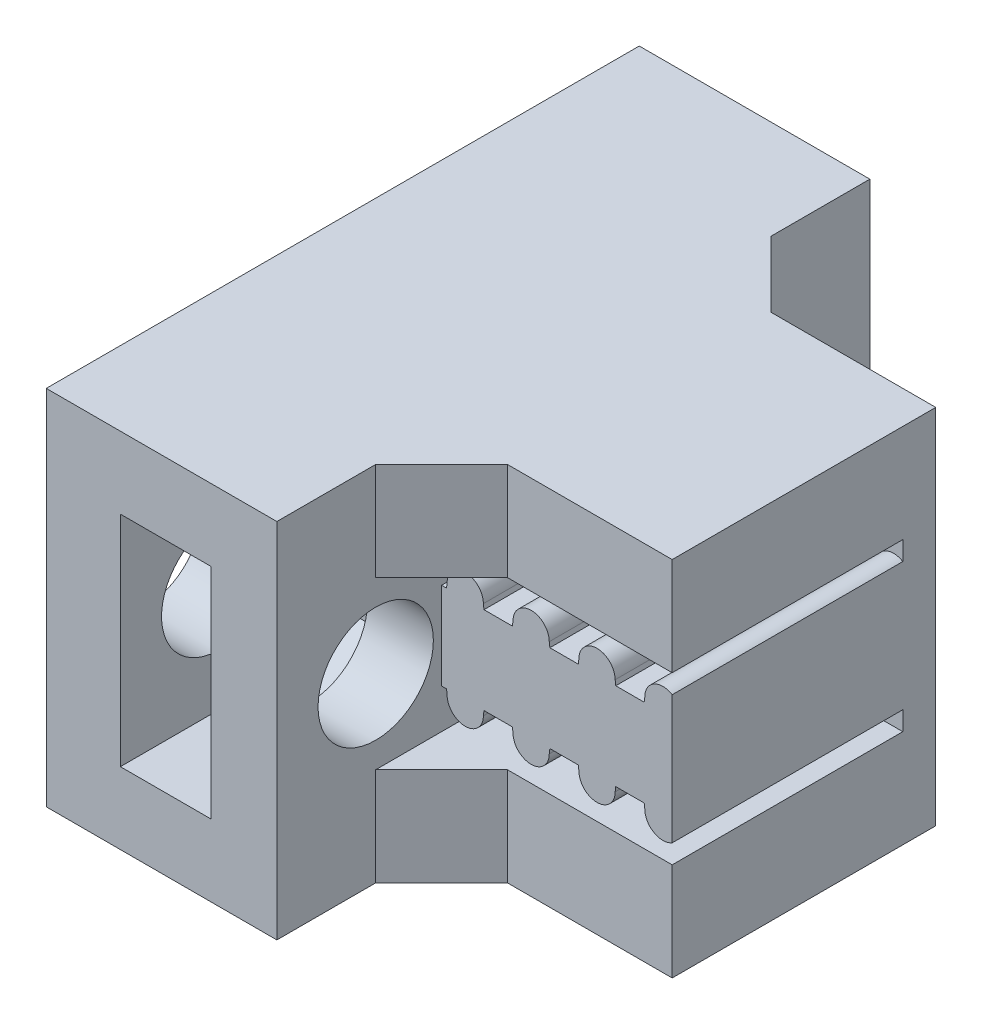
from build123d import *

# Parameters (mm, degrees)
SKETCH_1_W          = 7
SKETCH_1_H          = 11
EXTRUDE_1_DEPTH     = 8
CUT_EXTRUDE_1_DEPTH = 7
SKETCH_3_W          = 18
SKETCH_3_H          = 11
SKETCH_3_R          = 1.75
EXTRUDE_2_DEPTH     = 7
CUT_EXTRUDE_START   = -2
SKETCH_5_W          = 0.875
SKETCH_5_H          = 2.65
SKETCH_5_R          = 1.75
CUT_EXTRUDE_3_DEPTH = 2.75
CHAMFER_1_SIZE      = 2


with BuildPart() as part:
    # Эскиз1 → Бобышка-Вытянуть1 (new body)
    with BuildSketch(Plane.XY):
        Rectangle(SKETCH_1_W, SKETCH_1_H)
    extrude(amount=EXTRUDE_1_DEPTH)

    # Эскиз2 → Вырез-Вытянуть1 (cut)
    with BuildSketch(Plane.XY.offset(8)):
        with BuildLine():
            Line((-3.5, 2.525), (-3.5, 1.325))
            Line((-3.5, 1.325), (-3.35, 1.325))
            Line((-3.35, 1.325), (-3.331582316, 1.475))
            ThreePointArc((-3.331582316, 1.475), (-2.781582316, 2.025), (-2.231582316, 1.475))
            Line((-2.231582316, 1.475), (-2.213164632, 1.325))
            Line((-2.213164632, 1.325), (-1.35, 1.325))
            Line((-1.35, 1.325), (-1.331582316, 1.475))
            ThreePointArc((-1.331582316, 1.475), (-0.781582316, 2.025), (-0.231582316, 1.475))
            Line((-0.231582316, 1.475), (-0.213164632, 1.325))
            Line((-0.213164632, 1.325), (0.65, 1.325))
            Line((0.65, 1.325), (0.668417684, 1.475))
            ThreePointArc((0.668417684, 1.475), (1.218417684, 2.025), (1.768417684, 1.475))
            Line((1.768417684, 1.475), (1.786835368, 1.325))
            Line((1.786835368, 1.325), (2.65, 1.325))
            Line((2.65, 1.325), (2.668417684, 1.475))
            ThreePointArc((2.668417684, 1.475), (2.946728775, 1.953210348), (3.5, 1.947452537))
            Line((3.5, 1.947452537), (3.5, 2.525))
            Line((3.5, 2.525), (-3.5, 2.525))
        make_face()
        with BuildLine():
            Line((-3.35, -1.325), (-3.5, -1.325))
            Line((-3.5, -1.325), (-3.5, -2.525))
            Line((-3.5, -2.525), (3.5, -2.525))
            Line((3.5, -2.525), (3.5, -1.947452537))
            ThreePointArc((3.5, -1.947452537), (2.946728775, -1.953210348), (2.668417684, -1.475))
            Line((2.668417684, -1.475), (2.65, -1.325))
            Line((2.65, -1.325), (1.786835368, -1.325))
            Line((1.786835368, -1.325), (1.768417684, -1.475))
            ThreePointArc((1.768417684, -1.475), (1.218417684, -2.025), (0.668417684, -1.475))
            Line((0.668417684, -1.475), (0.65, -1.325))
            Line((0.65, -1.325), (-0.213164632, -1.325))
            Line((-0.213164632, -1.325), (-0.231582316, -1.475))
            ThreePointArc((-0.231582316, -1.475), (-0.781582316, -2.025), (-1.331582316, -1.475))
            Line((-1.331582316, -1.475), (-1.35, -1.325))
            Line((-1.35, -1.325), (-2.213164632, -1.325))
            Line((-2.213164632, -1.325), (-2.231582316, -1.475))
            ThreePointArc((-2.231582316, -1.475), (-2.781582316, -2.025), (-3.331582316, -1.475))
            Line((-3.331582316, -1.475), (-3.35, -1.325))
        make_face()
    extrude(amount=-CUT_EXTRUDE_1_DEPTH, mode=Mode.SUBTRACT)

    # Эскиз3 → Бобышка-Вытянуть2 (add)
    with BuildSketch(Plane.ZY.offset(3.5)):
        with Locations((4, 0)):
            Rectangle(SKETCH_3_W, SKETCH_3_H)
        with Locations((10, 0)):
            Circle(SKETCH_3_R, mode=Mode.SUBTRACT)
        with Locations((-2, 0)):
            Circle(SKETCH_3_R, mode=Mode.SUBTRACT)
    extrude(amount=EXTRUDE_2_DEPTH)

    # Эскиз5 → Вырез-Вытянуть3 (cut)
    # profile 1 of 5: a face of its own
    with BuildSketch(Plane(origin=(-3.5, 0, 0), x_dir=(0, 0, -1), z_dir=(1, 0, 0)).offset(CUT_EXTRUDE_START)):
        Polygon((2, 3.319764048), (4.875, 1.659882024), (4.875, -1.659882024), (2, -3.319764048), (-0.875, -1.659882024), (-0.875, 1.659882024), align=None)
    # profile 2 of 5: a face of its own
    with BuildSketch(Plane(origin=(-3.5, 0, 0), x_dir=(0, 0, -1), z_dir=(1, 0, 0)).offset(CUT_EXTRUDE_START)):
        Polygon((5, 3.319764048), (5, -3.319764048), (2, -3.319764048), (4.875, -1.659882024), (4.875, 1.659882024), (2, 3.319764048), align=None)
    # profile 3 of 5: a face of its own
    with BuildSketch(Plane(origin=(-3.5, 0, 0), x_dir=(0, 0, -1), z_dir=(1, 0, 0)).offset(CUT_EXTRUDE_START)):
        with Locations((-7.5625, 0)):
            Rectangle(SKETCH_5_W, SKETCH_5_H)
    # profile 4 of 5: a face of its own
    with BuildSketch(Plane(origin=(-3.5, 0, 0), x_dir=(0, 0, -1), z_dir=(1, 0, 0)).offset(CUT_EXTRUDE_START)):
        Polygon((-7.125, 1.659882024), (-10, 3.319764048), (-12.875, 1.659882024), (-12.875, -1.659882024), (-10, -3.319764048), (-7.125, -1.659882024), (-7.125, -1.325), (-8, -1.325), (-8, 1.325), (-7.125, 1.325), align=None)
        with Locations((-10, 0)):
            Circle(SKETCH_5_R, mode=Mode.SUBTRACT)
    # profile 5 of 5: a face of its own
    with BuildSketch(Plane(origin=(-3.5, 0, 0), x_dir=(0, 0, -1), z_dir=(1, 0, 0)).offset(CUT_EXTRUDE_START)):
        Polygon((-12.875, 1.659882024), (-10, 3.319764048), (-13, 3.319764048), (-13, -3.319764048), (-10, -3.319764048), (-12.875, -1.659882024), align=None)
    extrude(amount=-CUT_EXTRUDE_3_DEPTH, mode=Mode.SUBTRACT)

    # Фаска1
    # the kernel refuses this chamfer: 2 mm, written as the material it adds along each edge
    with BuildSketch(Plane(origin=(-3.5, 5.5, 8), x_dir=(1, 0, 0), z_dir=(0, -1, 0)), Plane(origin=(-3.5, -2.525, 8), x_dir=(1, 0, 0), z_dir=(0, -1, 0))) as chamfer_1_piece_1:
        Polygon((CHAMFER_1_SIZE, 0), (0, CHAMFER_1_SIZE), (0, 0), align=None)
    extrude(amount=2.975)
    with BuildSketch(Plane(origin=(-3.5, 10.643365976, 8), x_dir=(1, 0, 0), z_dir=(0, -1, 0))) as chamfer_1_piece_2_section:
        Polygon((CHAMFER_1_SIZE, 0), (0, CHAMFER_1_SIZE), (0, 0), align=None)
    chamfer_1_piece_2 = extrude(amount=13.261731952, mode=Mode.PRIVATE)
    chamfer_1_piece_2 = split(chamfer_1_piece_2, bisect_by=Plane(origin=(-3.5, -2.525, 8), z_dir=(0, -1, 0)), keep=Keep.TOP, mode=Mode.PRIVATE)
    add(chamfer_1_piece_2)
    with BuildSketch(Plane(origin=(-3.5, 2.618365976, 8), x_dir=(1, 0, 0), z_dir=(0, -1, 0))) as chamfer_1_piece_3_section:
        Polygon((CHAMFER_1_SIZE, 0), (0, CHAMFER_1_SIZE), (0, 0), align=None)
    chamfer_1_piece_3 = extrude(amount=13.261731952, mode=Mode.PRIVATE)
    chamfer_1_piece_3 = split(chamfer_1_piece_3, bisect_by=Plane(origin=(-3.5, 2.525, 8), z_dir=(0, 1, 0)), keep=Keep.TOP, mode=Mode.PRIVATE)
    add(chamfer_1_piece_3)
    with BuildSketch(Plane(origin=(-3.5, 5.5, 0), x_dir=(0, 0, -1), z_dir=(0, -1, 0))) as chamfer_1_piece_4_section:
        Polygon((CHAMFER_1_SIZE, 0), (0, CHAMFER_1_SIZE), (0, 0), align=None)
    chamfer_1_piece_4 = extrude(amount=11, mode=Mode.PRIVATE)
    chamfer_1_piece_4 = chamfer_1_piece_4 - Plane(origin=(-3.5, 0, -2), x_dir=(0, 0, 1), z_dir=(1, 0, 0)) * Cylinder(1.75, 30, mode=Mode.PRIVATE)
    add(chamfer_1_piece_4)


solid = part.part
